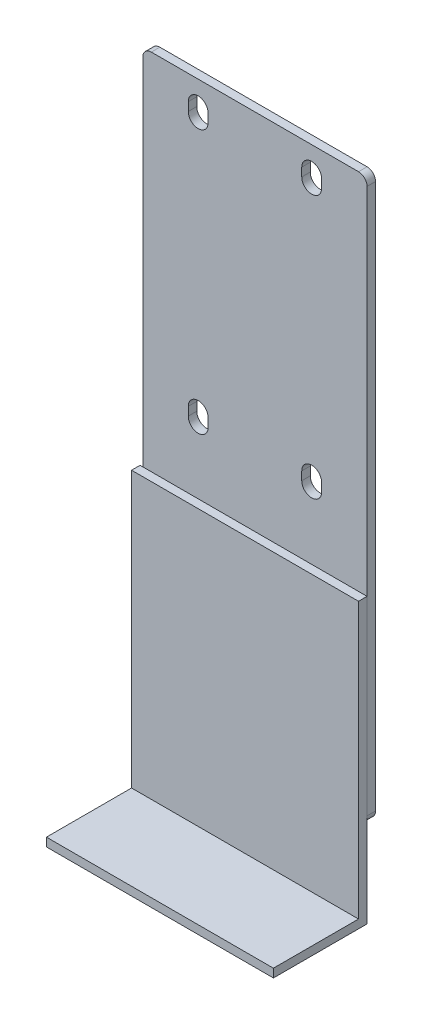
from build123d import *

# Parameters (mm, degrees)
MODEL_R             = 3.4
BOSS_EXTRUDE1_DEPTH = 3
SKETCH2_W           = 80
SKETCH2_H           = 100
BOSS_EXTRUDE2_DEPTH = 3
SKETCH3_W           = 80
SKETCH3_H           = 3
BOSS_EXTRUDE3_DEPTH = 30


with BuildPart() as part:
    # Model → Boss-Extrude1 (new body)
    with BuildSketch(Plane.XY):
        with BuildLine():
            Line((60.755732344, 45.927973601), (60.755732344, 238.042706995))
            ThreePointArc((60.755732344, 238.042706995), (61.634412001, 240.164027338), (63.755732344, 241.042706995))
            Line((63.755732344, 241.042706995), (136.786203682, 241.042706995))
            ThreePointArc((136.786203682, 241.042706995), (138.907524026, 240.164027338), (139.786203682, 238.042706995))
            Line((139.786203682, 238.042706995), (139.786203682, 45.927973601))
            ThreePointArc((139.786203682, 45.927973601), (138.907524026, 43.806653257), (136.786203682, 42.927973601))
            Line((136.786203682, 42.927973601), (63.755732344, 42.927973601))
            ThreePointArc((63.755732344, 42.927973601), (61.634412001, 43.806653257), (60.755732344, 45.927973601))
        make_face()
        with Locations((70.270968013, 102.927973601)):
            Circle(MODEL_R, mode=Mode.SUBTRACT)
        with Locations((70.270968013, 72.927973601)):
            Circle(MODEL_R, mode=Mode.SUBTRACT)
        with Locations((130.270968013, 102.927973601)):
            Circle(MODEL_R, mode=Mode.SUBTRACT)
        with Locations((130.270968013, 72.927973601)):
            Circle(MODEL_R, mode=Mode.SUBTRACT)
        with BuildLine():
            Line((83.770968013, 136.427973601), (83.770968013, 139.427973601))
            ThreePointArc((83.770968013, 139.427973601), (80.270968013, 142.927973601), (76.770968013, 139.427973601))
            Line((76.770968013, 139.427973601), (76.770968013, 136.427973601))
            ThreePointArc((76.770968013, 136.427973601), (80.270968013, 132.927973601), (83.770968013, 136.427973601))
        make_face(mode=Mode.SUBTRACT)
        with BuildLine():
            Line((123.770968013, 136.710031471), (123.770968013, 139.710031471))
            ThreePointArc((123.770968013, 139.710031471), (120.270968013, 143.210031471), (116.770968013, 139.710031471))
            Line((116.770968013, 139.710031471), (116.770968013, 136.710031471))
            ThreePointArc((116.770968013, 136.710031471), (120.270968013, 133.210031471), (123.770968013, 136.710031471))
        make_face(mode=Mode.SUBTRACT)
        with BuildLine():
            Line((83.770968013, 229.427973601), (83.770968013, 232.427973601))
            ThreePointArc((83.770968013, 232.427973601), (80.270968013, 235.927973601), (76.770968013, 232.427973601))
            Line((76.770968013, 232.427973601), (76.770968013, 229.427973601))
            ThreePointArc((76.770968013, 229.427973601), (80.270968013, 225.927973601), (83.770968013, 229.427973601))
        make_face(mode=Mode.SUBTRACT)
        with BuildLine():
            Line((123.770968013, 229.427973601), (123.770968013, 232.427973601))
            ThreePointArc((123.770968013, 232.427973601), (120.270968013, 235.927973601), (116.770968013, 232.427973601))
            Line((116.770968013, 232.427973601), (116.770968013, 229.427973601))
            ThreePointArc((116.770968013, 229.427973601), (120.270968013, 225.927973601), (123.770968013, 229.427973601))
        make_face(mode=Mode.SUBTRACT)
    extrude(amount=BOSS_EXTRUDE1_DEPTH)


with BuildPart() as body_2:
    # Sketch2 → Boss-Extrude2 (new body)
    with BuildSketch(Plane.XY.offset(3)):
        with Locations((-202.453392637, 38.408485808)):
            Rectangle(SKETCH2_W, SKETCH2_H)
    extrude(amount=BOSS_EXTRUDE2_DEPTH)

    # Sketch3 → Boss-Extrude3 (add)
    with BuildSketch(Plane.XY.offset(6)):
        with Locations((-202.453392637, -10.091514192)):
            Rectangle(SKETCH3_W, SKETCH3_H)
    extrude(amount=BOSS_EXTRUDE3_DEPTH)


with BuildPart() as body_2_1:
    # Body-Move/Copy2: read off the stored shape, not the designer's step
    # Body-Move/Copy2: moved
    add(body_2.part.moved(Location((302.2395963, 0, 0))))


with BuildPart() as body_2_2:
    # Body-Move/Copy4: read off the stored shape, not the designer's step
    # Body-Move/Copy4: moved
    add(body_2_1.part.moved(Location((0, 24.5194878, 0))))


solid = Compound([part.part, body_2_2.part])
